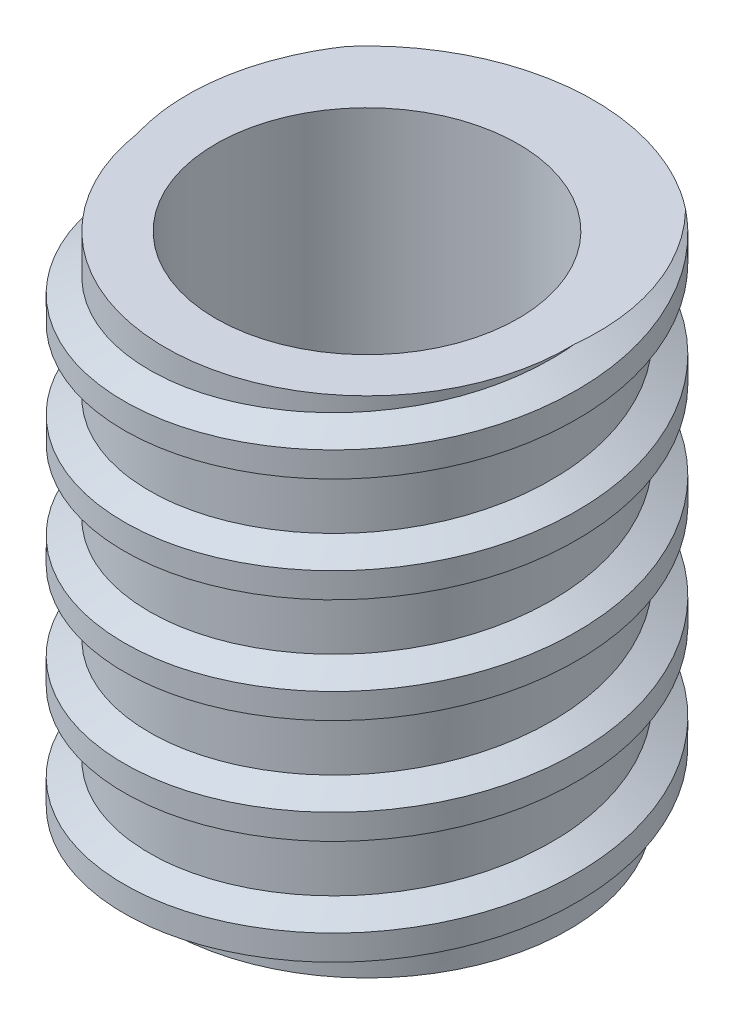
from build123d import *

# Parameters (mm, degrees)
SKETCH1_R           = 8
SKETCH1_R_2         = 6
BOSS_EXTRUDE1_DEPTH = 20
SWEEP1_PITCH        = 4.15
SKETCH8_R           = 17.321445469
CUT_EXTRUDE1_DEPTH  = 29.053674784
SKETCH9_R           = 15.433998998
CUT_EXTRUDE2_DEPTH  = 24.706539343


with BuildPart() as part:
    # Sketch1 → Boss-Extrude1 (new body)
    with BuildSketch(Plane(origin=(0, 0, 0), x_dir=(1, 0, 0), z_dir=(0, 1, 0))):
        with Locations(Location((0, 0, 0), (0, 0, 270))):
            Circle(SKETCH1_R)
        with Locations(Location((0, 0, 0), (0, 0, 270))):
            Circle(SKETCH1_R_2, mode=Mode.SUBTRACT)
    extrude(amount=BOSS_EXTRUDE1_DEPTH)

    # Sweep1: the profile of Sketch3 profile screwed along a right-hand helix of 9.75 turns, 12 arcs to a turn; built about Z, then put on its axis
    sweep1_z = Axis((0, 0, 0), (0, 0, 1))
    sweep1_corners = [(7.9997, 0, -5.000173205), (7.9997, 0, -2.845126257), (9, 0, -3.422649731), (9, 0, -4.422649731)]
    with BuildLine(mode=Mode.PRIVATE) as sweep1_profile:
        Line(sweep1_corners[0], sweep1_corners[1])
        Line(sweep1_corners[1], sweep1_corners[2])
        Line(sweep1_corners[2], sweep1_corners[3])
        Line(sweep1_corners[3], sweep1_corners[0])
    sweep1_cap = Face(sweep1_profile.wire())
    sweep1_turn_angles = [0, 15, 30, 45, 60, 75, 90, 105, 120, 135, 150, 165, 180, 195, 210, 225, 240, 255, 270, 285, 300, 315, 330, 345, 360]
    sweep1_turn_weights = [1, 0.9659258262890683, 1, 0.9659258262890683, 1, 0.9659258262890683, 1, 0.9659258262890683, 1, 0.9659258262890683, 1, 0.9659258262890683, 1, 0.9659258262890683, 1, 0.9659258262890683, 1, 0.9659258262890683, 1, 0.9659258262890683, 1, 0.9659258262890683, 1, 0.9659258262890683, 1]
    sweep1_turn_rails = [Edge.make_bspline([Vector(p[0], p[1], 0).rotate(sweep1_z, sweep1_turn_angles[k]) / sweep1_turn_weights[k] + Vector(0, 0, p[2] + SWEEP1_PITCH * sweep1_turn_angles[k] / 360) for k in range(25)], [0, 0, 0, 1, 1, 2, 2, 3, 3, 4, 4, 5, 5, 6, 6, 7, 7, 8, 8, 9, 9, 10, 10, 11, 11, 12, 12, 12], 2, sweep1_turn_weights) for p in sweep1_corners]
    sweep1_turn_sides = [Face.make_surface_from_curves(sweep1_turn_rails[p[0]], sweep1_turn_rails[p[1]]) for p in [(0, 1), (1, 2), (2, 3), (3, 0)]]
    sweep1_last_angles = [3240, 3255, 3270, 3285, 3300, 3315, 3330, 3345, 3360, 3375, 3390, 3405, 3420, 3435, 3450, 3465, 3480, 3495, 3510]
    sweep1_last_weights = [1, 0.9659258262890683, 1, 0.9659258262890683, 1, 0.9659258262890683, 1, 0.9659258262890683, 1, 0.9659258262890683, 1, 0.9659258262890683, 1, 0.9659258262890683, 1, 0.9659258262890683, 1, 0.9659258262890662, 1]
    sweep1_last_rails = [Edge.make_bspline([Vector(p[0], p[1], 0).rotate(sweep1_z, sweep1_last_angles[k]) / sweep1_last_weights[k] + Vector(0, 0, p[2] + SWEEP1_PITCH * sweep1_last_angles[k] / 360) for k in range(19)], [0, 0, 0, 1, 1, 2, 2, 3, 3, 4, 4, 5, 5, 6, 6, 7, 7, 8, 8, 9, 9, 9], 2, sweep1_last_weights) for p in sweep1_corners]
    sweep1_last_sides = [Face.make_surface_from_curves(sweep1_last_rails[p[0]], sweep1_last_rails[p[1]]) for p in [(0, 1), (1, 2), (2, 3), (3, 0)]]
    sweep1 = Plane(origin=(0, 0, 0), x_dir=(-1, 0, 0), z_dir=(0, 1, 0)) * Solid(Shell([*[p.moved(Location((0, 0, SWEEP1_PITCH * i))) for i in range(9) for p in sweep1_turn_sides], *sweep1_last_sides, sweep1_cap, sweep1_cap.rotate(sweep1_z, 3510).moved(Location((0, 0, SWEEP1_PITCH * 3510 / 360)))]))
    add(sweep1)

    # Sketch8 → Cut-Extrude1 (cut, through all)
    with BuildSketch(Plane(origin=(0, 20, 0), x_dir=(1, 0, 0), z_dir=(0, 1, 0))):
        Circle(SKETCH8_R)
    extrude(amount=CUT_EXTRUDE1_DEPTH, mode=Mode.SUBTRACT)

    # Sketch9 → Cut-Extrude2 (cut, through all)
    with BuildSketch(Plane.XZ):
        Circle(SKETCH9_R)
    extrude(amount=CUT_EXTRUDE2_DEPTH, mode=Mode.SUBTRACT)


solid = part.part
